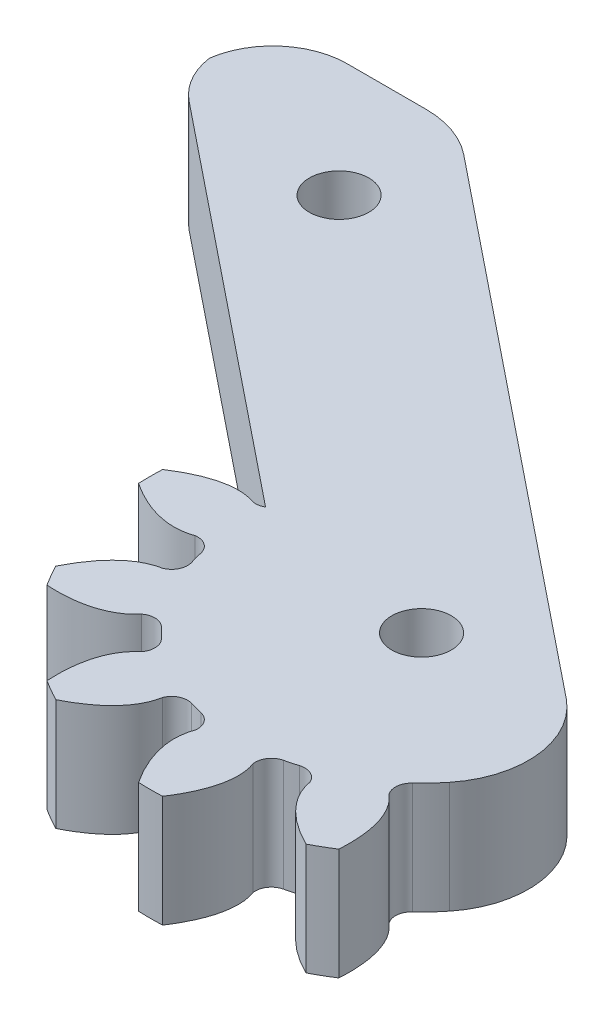
from build123d import *

# Parameters (mm, degrees)
RESSALTO_EXTRUS_O1_DEPTH = 6
CORTE_EXTRUS_O1_DEPTH    = 63.752949305
CORTE_EXTRUS_O2_DEPTH    = 63.752949305
CORTE_EXTRUS_O3_DEPTH    = 63.752949305
CORTE_EXTRUS_O4_DEPTH    = 63.752949305
ESBO_O6_R                = 1.6
CORTE_EXTRUS_O5_DEPTH    = 63.752949305
ESBO_O7_R                = 1.6
CORTE_EXTRUS_O6_DEPTH    = 63.752949305


with BuildPart() as part:
    # Esboço1 → Ressalto-extrusão1 (new body)
    with BuildSketch(Plane.XZ.offset(6)):
        with BuildLine():
            Line((-35.053391166, -1.665767354), (-56.005959689, -18.507024557))
            ThreePointArc((-56.005959689, -18.507024557), (-56.976417823, -19.646228266), (-57.460270003, -21.062371319))
            ThreePointArc((-57.460270003, -21.062371319), (-56.122071197, -23.520718894), (-53.5, -24.5))
            Line((-53.5, -24.5), (-49.26036734, -24.5))
            ThreePointArc((-49.26036734, -24.5), (-47.599906261, -24.216234622), (-46.127917729, -23.397147602))
            Line((-46.127917729, -23.397147602), (-18.051593362, -0.829957358))
            ThreePointArc((-18.051593362, -0.829957358), (-16.213367114, 2.526467109), (-17.286895371, 6.199639856))
            ThreePointArc((-17.286895371, 6.199639856), (-17.752824847, 6.738395184), (-18.256300836, 7.242239912))
            ThreePointArc((-18.256300836, 7.242239912), (-18.528297677, 7.80831066), (-18.343735303, 8.408606506))
            add(Edge.make_bspline(
                [(-18.343735303, 8.408606506), (-16.98173735, 9.54416389), (-17.156613946, 12.29450716)],
                knots=[0.078549619, 0.078549619, 0.078549619, 0.770539159, 0.770539159, 0.770539159], degree=2, weights=[1, 0.940738559, 1]))
            ThreePointArc((-17.156613946, 12.29450716), (-32.291666667, 12.629537139), (-39.569048555, -0.645317995))
            add(Edge.make_bspline(
                [(-39.569048555, -0.645317995), (-37.274619711, -2.171937204), (-35.610199193, -1.560191069)],
                knots=[2.371053495, 2.371053495, 2.371053495, 3.063043035, 3.063043035, 3.063043035], degree=2, weights=[1, 0.940738559, 1]))
            ThreePointArc((-35.610199193, -1.560191069), (-35.322864942, -1.565881251), (-35.053391166, -1.665767354))
        make_face()
    extrude(amount=-RESSALTO_EXTRUS_O1_DEPTH)

    # Esboço2 → Corte-extrusão1 (cut, through all)
    with BuildSketch(Plane(origin=(0, 0, 0), x_dir=(-1, 0, 0), z_dir=(0, 1, 0))):
        with BuildLine():
            ThreePointArc((24.354682005, 14.569048555), (21.225555592, 14.0864183), (18.274337499, 12.939825155))
            add(Edge.make_bspline(
                [(21.046065504, 9.968797575), (20.743642938, 11.716101094), (18.274337499, 12.939825155)],
                knots=[3.220142273, 3.220142273, 3.220142273, 3.912131812, 3.912131812, 3.912131812], degree=2, weights=[1, 0.940738559, 1]))
            ThreePointArc((21.046065504, 9.968797575), (21.47365577, 9.508813947), (22.099885838, 9.461334748))
            ThreePointArc((22.099885838, 9.461334748), (22.438769866, 9.558640989), (22.780905164, 9.643813326))
            ThreePointArc((22.780905164, 9.643813326), (23.299496712, 9.998046554), (23.439808931, 10.610199193))
            add(Edge.make_bspline(
                [(24.354682005, 14.569048555), (22.828062796, 12.274619711), (23.439808931, 10.610199193)],
                knots=[2.371053495, 2.371053495, 2.371053495, 3.063043035, 3.063043035, 3.063043035], degree=2, weights=[1, 0.940738559, 1]))
        make_face()
    extrude(amount=-CORTE_EXTRUS_O1_DEPTH, mode=Mode.SUBTRACT)

    # Esboço3 → Corte-extrusão2 (cut, through all)
    with BuildSketch(Plane(origin=(0, 0, 0), x_dir=(-1, 0, 0), z_dir=(0, 1, 0))):
        with BuildLine():
            ThreePointArc((31.725662501, 12.939825155), (28.774444408, 14.0864183), (25.645317995, 14.569048555))
            add(Edge.make_bspline(
                [(26.560191069, 10.610199193), (27.171937204, 12.274619711), (25.645317995, 14.569048555)],
                knots=[3.220142273, 3.220142273, 3.220142273, 3.912131812, 3.912131812, 3.912131812], degree=2, weights=[1, 0.940738559, 1]))
            ThreePointArc((26.560191069, 10.610199193), (26.700503288, 9.998046554), (27.219094836, 9.643813326))
            ThreePointArc((27.219094836, 9.643813326), (27.561230134, 9.558640989), (27.900114162, 9.461334748))
            ThreePointArc((27.900114162, 9.461334748), (28.52634423, 9.508813947), (28.953934496, 9.968797575))
            add(Edge.make_bspline(
                [(31.725662501, 12.939825155), (29.256357062, 11.716101094), (28.953934496, 9.968797575)],
                knots=[2.371053495, 2.371053495, 2.371053495, 3.063043035, 3.063043035, 3.063043035], degree=2, weights=[1, 0.940738559, 1]))
        make_face()
    extrude(amount=-CORTE_EXTRUS_O2_DEPTH, mode=Mode.SUBTRACT)

    # Esboço4 → Corte-extrusão3 (cut, through all)
    with BuildSketch(Plane(origin=(0, 0, 0), x_dir=(-1, 0, 0), z_dir=(0, 1, 0))):
        with BuildLine():
            ThreePointArc((37.29450716, 7.843386054), (35.311973892, 10.311973892), (32.843386054, 12.29450716))
            add(Edge.make_bspline(
                [(31.656264697, 8.408606506), (33.01826265, 9.54416389), (32.843386054, 12.29450716)],
                knots=[3.220142273, 3.220142273, 3.220142273, 3.912131812, 3.912131812, 3.912131812], degree=2, weights=[1, 0.940738559, 1]))
            ThreePointArc((31.656264697, 8.408606506), (31.471702323, 7.80831066), (31.743699164, 7.242239912))
            ThreePointArc((31.743699164, 7.242239912), (31.997410855, 6.997410855), (32.242239912, 6.743699164))
            ThreePointArc((32.242239912, 6.743699164), (32.80831066, 6.471702323), (33.408606506, 6.656264697))
            add(Edge.make_bspline(
                [(37.29450716, 7.843386054), (34.54416389, 8.01826265), (33.408606506, 6.656264697)],
                knots=[5.512646149, 5.512646149, 5.512646149, 6.204635688, 6.204635688, 6.204635688], degree=2, weights=[1, 0.940738559, 1]))
        make_face()
    extrude(amount=-CORTE_EXTRUS_O3_DEPTH, mode=Mode.SUBTRACT)

    # Esboço5 → Corte-extrusão4 (cut, through all)
    with BuildSketch(Plane(origin=(0, 0, 0), x_dir=(-1, 0, 0), z_dir=(0, 1, 0))):
        with BuildLine():
            ThreePointArc((39.569048555, 0.645317995), (39.0864183, 3.774444408), (37.939825155, 6.725662501))
            add(Edge.make_bspline(
                [(34.968797575, 3.953934496), (36.716101094, 4.256357062), (37.939825155, 6.725662501)],
                knots=[3.220142273, 3.220142273, 3.220142273, 3.912131812, 3.912131812, 3.912131812], degree=2, weights=[1, 0.940738559, 1]))
            ThreePointArc((34.968797575, 3.953934496), (34.508813947, 3.52634423), (34.461334748, 2.900114162))
            ThreePointArc((34.461334748, 2.900114162), (34.558640989, 2.561230134), (34.643813326, 2.219094836))
            ThreePointArc((34.643813326, 2.219094836), (34.998046554, 1.700503288), (35.610199193, 1.560191069))
            add(Edge.make_bspline(
                [(39.569048555, 0.645317995), (37.274619711, 2.171937204), (35.610199193, 1.560191069)],
                knots=[2.371053495, 2.371053495, 2.371053495, 3.063043035, 3.063043035, 3.063043035], degree=2, weights=[1, 0.940738559, 1]))
        make_face()
    extrude(amount=-CORTE_EXTRUS_O4_DEPTH, mode=Mode.SUBTRACT)

    # Esboço6 → Corte-extrusão5 (cut, through all)
    with BuildSketch(Plane.XZ.offset(6)):
        with Locations((-25, 0)):
            Circle(ESBO_O6_R)
    extrude(amount=-CORTE_EXTRUS_O5_DEPTH, mode=Mode.SUBTRACT)

    # Esboço7 → Corte-extrusão6 (cut, through all)
    with BuildSketch(Plane(origin=(0, 0, 0), x_dir=(-1, 0, 0), z_dir=(0, 1, 0))):
        with Locations((47.598401843, -18.16414524)):
            Circle(ESBO_O7_R)
    extrude(amount=-CORTE_EXTRUS_O6_DEPTH, mode=Mode.SUBTRACT)


solid = part.part
